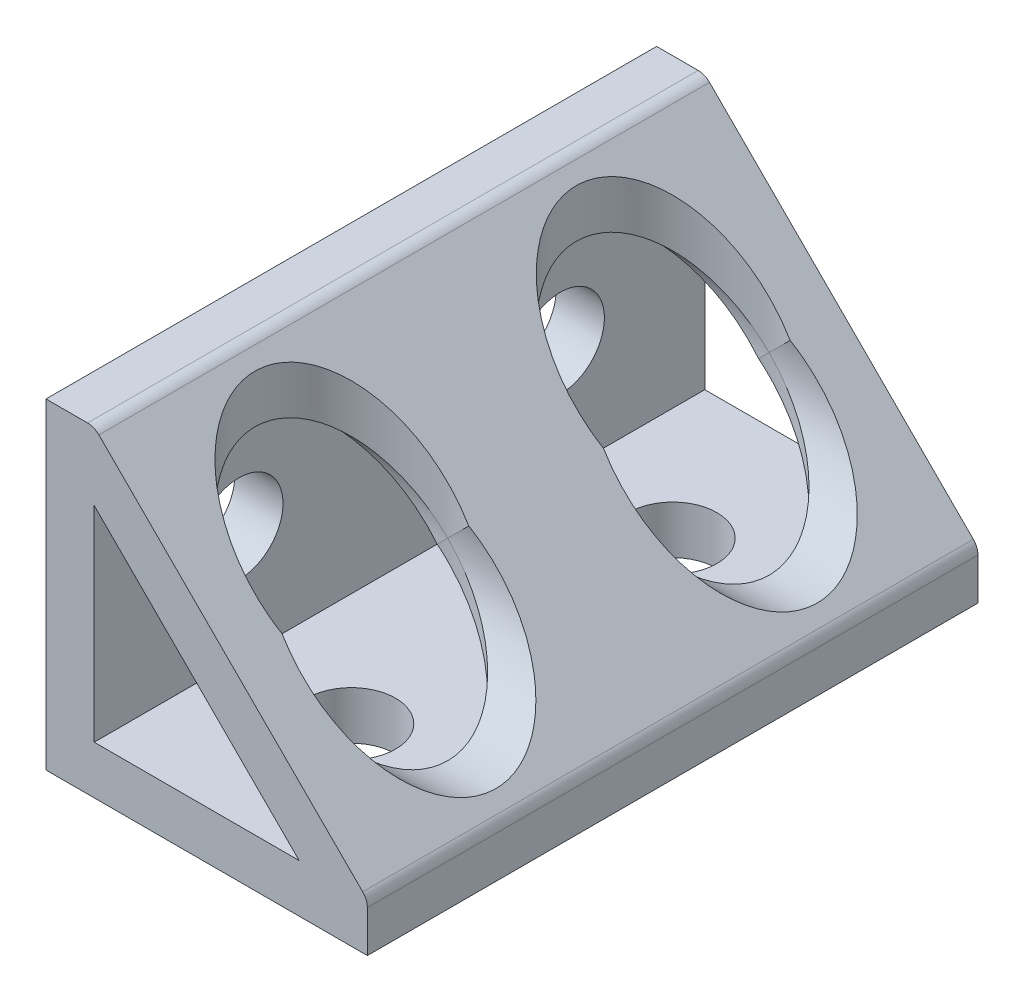
from build123d import *

# Parameters (mm, degrees)
BOSS_EXTRUDE1_START     = -17
BOSS_EXTRUDE1_OUTLINE_W = 38
BOSS_EXTRUDE1_OUTLINE_H = 17
BOSS_EXTRUDE1_DEPTH     = 20
BOSS_EXTRUDE1_2_DEPTH   = 3
BOSS_EXTRUDE1_START_2   = 3
BOSS_EXTRUDE1_3_DEPTH   = 17
BOSS_EXTRUDE1_START_3   = -19
BOSS_EXTRUDE1_4_DEPTH   = 38
SKETCH2_W               = 20
SKETCH2_H               = 38
BOSS_EXTRUDE2_DEPTH     = 3
F_10_CLEARANCE_HOLE1_D  = 5.5
F_10_CLEARANCE_HOLE2_D  = 5.5
F_10_CLEARANCE_HOLE3_D  = 5.5
F_10_CLEARANCE_HOLE4_D  = 5.5
FILLET1_R               = 1


with BuildPart() as part:
    # Boss-Extrude1: read off the stored shape, not the designer's step
    # Boss-Extrude1 outline → Boss-Extrude1 (new body)
    with BuildSketch(Plane.ZY.offset(-3).offset(BOSS_EXTRUDE1_START)):
        with Locations((0, 11.5)):
            Rectangle(BOSS_EXTRUDE1_OUTLINE_W, BOSS_EXTRUDE1_OUTLINE_H)
        with BuildLine():
            ThreePointArc((-15.967743378, 9.378679656), (-10, 16), (-4.032256622, 9.378679656))
            ThreePointArc((-4.032256622, 9.378679656), (-10, 4), (-15.967743378, 9.378679656))
        make_face(mode=Mode.SUBTRACT)
        with BuildLine():
            ThreePointArc((4.032256622, 9.378679656), (10, 16), (15.967743378, 9.378679656))
            ThreePointArc((15.967743378, 9.378679656), (10, 4), (4.032256622, 9.378679656))
        make_face(mode=Mode.SUBTRACT)
    extrude(amount=BOSS_EXTRUDE1_DEPTH)

    # Boss-Extrude1 2 outline → Boss-Extrude1 2 (add)
    with BuildSketch(Plane.ZY.offset(-3)):
        with BuildLine():
            ThreePointArc((4.032256622, 9.378679656), (10, 4), (15.967743378, 9.378679656))
            ThreePointArc((15.967743378, 9.378679656), (10, 16), (4.032256622, 9.378679656))
        make_face()
        with BuildLine():
            ThreePointArc((-15.967743378, 9.378679656), (-10, 4), (-4.032256622, 9.378679656))
            ThreePointArc((-4.032256622, 9.378679656), (-10, 16), (-15.967743378, 9.378679656))
        make_face()
    extrude(amount=BOSS_EXTRUDE1_2_DEPTH)

    # Boss-Extrude1 3 outline → Boss-Extrude1 3 (cut)
    with BuildSketch(Plane(origin=(0, 0, 0), x_dir=(1, 0, 0), z_dir=(0, 1, 0)).offset(BOSS_EXTRUDE1_START_2)):
        with BuildLine():
            ThreePointArc((9.378679656, -15.967743378), (16, -10), (9.378679656, -4.032256622))
            ThreePointArc((9.378679656, -4.032256622), (4, -10), (9.378679656, -15.967743378))
        make_face()
        with BuildLine():
            ThreePointArc((9.378679656, 4.032256622), (16, 10), (9.378679656, 15.967743378))
            ThreePointArc((9.378679656, 15.967743378), (4, 10), (9.378679656, 4.032256622))
        make_face()
    extrude(amount=BOSS_EXTRUDE1_3_DEPTH, mode=Mode.SUBTRACT)

    # Boss-Extrude1 4 outline → Boss-Extrude1 4 (cut)
    with BuildSketch(Plane.XY.offset(BOSS_EXTRUDE1_START_3)):
        Polygon((3, 3), (15.757359313, 3), (3, 15.757359313), align=None)
        Polygon((3, 20), (20, 3), (20, 20), align=None)
    extrude(amount=BOSS_EXTRUDE1_4_DEPTH, mode=Mode.SUBTRACT)

    # Sketch2 → Boss-Extrude2 (add)
    with BuildSketch(Plane.XZ.offset(-3)):
        with Locations((10, 0)):
            Rectangle(SKETCH2_W, SKETCH2_H)
    extrude(amount=BOSS_EXTRUDE2_DEPTH)

    # #10 Clearance Hole1 (through all)
    with Locations(Plane(origin=(0, 3, 0), x_dir=(1, 0, 0), z_dir=(0, 1, 0))):
        with Locations((10, -10)):
            Hole(F_10_CLEARANCE_HOLE1_D / 2)

    # #10 Clearance Hole2 (through all)
    with Locations(Plane.ZY):
        with Locations((-10, 10)):
            Hole(F_10_CLEARANCE_HOLE2_D / 2)

    # #10 Clearance Hole3 (through all)
    with Locations(Plane.ZY):
        with Locations((10, 10)):
            Hole(F_10_CLEARANCE_HOLE3_D / 2)

    # #10 Clearance Hole4 (through all)
    with Locations(Plane(origin=(0, 0, 0), x_dir=(-1, 0, 0), z_dir=(0, -1, 0))):
        with Locations((-10, 10)):
            Hole(F_10_CLEARANCE_HOLE4_D / 2)

    # Fillet1
    fillet1_edges = [part.edges().sort_by_distance(p)[0] for p in [
        (20, 3, 0),
        (3, 20, 0),
    ]]
    fillet(fillet1_edges, radius=FILLET1_R)


solid = part.part
